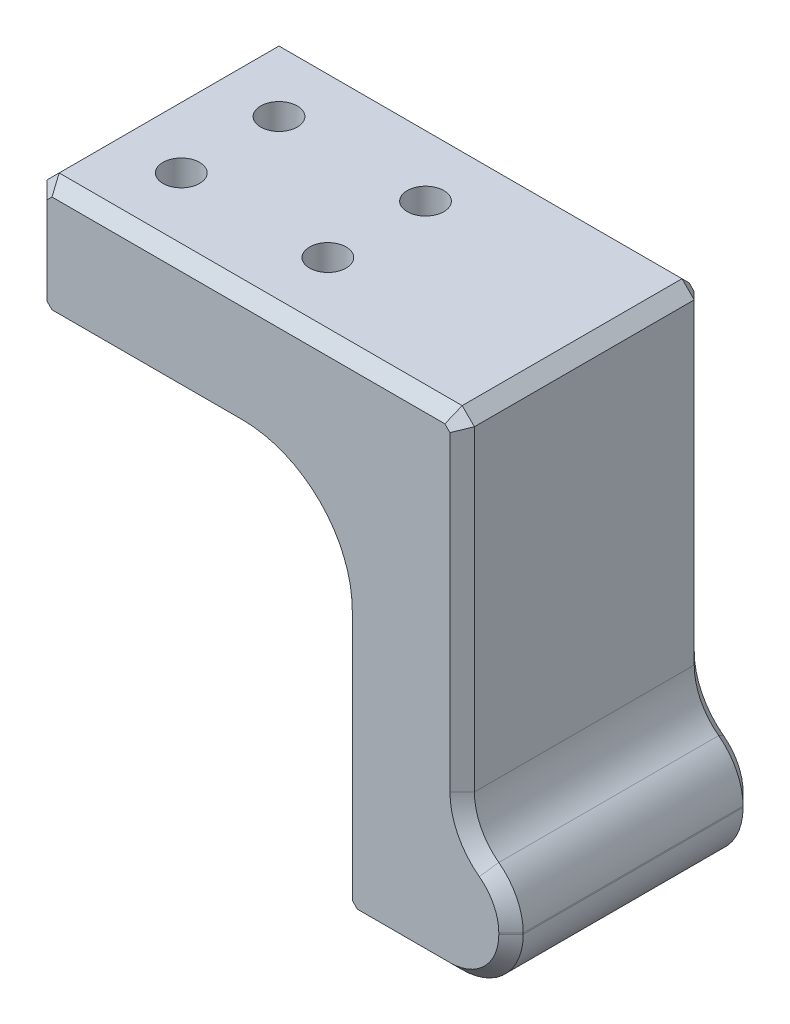
from build123d import *

# Parameters (mm, degrees)
EXTRUDE_3_DEPTH          = 20
FILLET_3_R               = 5
FILLET_4_R               = 5
FILLET_5_R               = 8
CUT_EXTRUDE_1_DEPTH      = 20
CUT_EXTRUDE_1_DEPTH_BACK = 20
SKETCH_6_R               = 1.5
CHAMFER_1_SIZE           = 1
CHAMFER_2_SIZE           = 1


with BuildPart() as part:
    # 草图5 → 凸台-拉伸3 (new body)
    with BuildSketch(Plane.XY):
        Polygon((-8.414313081, 8), (26.585686919, 8), (26.585686919, -22), (30.585686919, -22), (30.585686919, -32), (16.585686919, -32), (16.585686919, -2), (-8.414313081, -2), align=None)
    extrude(amount=EXTRUDE_3_DEPTH)

    # 圆角3
    # the kernel refuses this fillet: 5 mm, written as the material it takes off along each edge
    with BuildSketch(Plane(origin=(30.585686919, -32, -12.5), x_dir=(0, 1, 0), z_dir=(0, 0, 1))) as fillet_3_piece_1:
        with BuildLine():
            CenterArc((FILLET_3_R, FILLET_3_R), FILLET_3_R, 180, 90)
            Line((0, FILLET_3_R), (-FILLET_3_R * 0.02, FILLET_3_R))
            Line((-FILLET_3_R * 0.02, FILLET_3_R), (-FILLET_3_R * 0.02, -FILLET_3_R * 0.02))
            Line((-FILLET_3_R * 0.02, -FILLET_3_R * 0.02), (FILLET_3_R, -FILLET_3_R * 0.02))
            Line((FILLET_3_R, -FILLET_3_R * 0.02), (FILLET_3_R, 0))
        make_face()
    extrude(amount=45, mode=Mode.SUBTRACT)
    with BuildSketch(Plane(origin=(30.585686919, -22, -12.247448714), x_dir=(-1.0, -1.569411267609618e-12, 0), z_dir=(0, 0, 1))) as fillet_3_piece_2:
        with BuildLine():
            CenterArc((5, 4.898979486), FILLET_3_R, 180, 78.463040967)
            Line((0, 4.898979486), (-0.1, 4.898979486))
            Line((-0.1, 4.898979486), (-0.1, 0))
            Line((-0.1, 0), (0, -0.1))
            ThreePointArc((0, -0.1), (2, -0.1), (3.98, -0.09797959))
            Line((3.98, -0.09797959), (4, 0))
        make_face()
    extrude(amount=44.494897428, mode=Mode.SUBTRACT)

    # 圆角4
    fillet_4_edges = [part.edges().sort_by_distance(p)[0] for p in [
        (26.585686919, -22, 10),
    ]]
    fillet(fillet_4_edges, radius=FILLET_4_R)

    # 圆角5
    fillet_5_edges = [part.edges().sort_by_distance(p)[0] for p in [
        (16.585686919, -2, 10),
    ]]
    fillet(fillet_5_edges, radius=FILLET_5_R)

    # 草图6 → 切除-拉伸1 (cut, two sides: drawn at the far end of the back side and taken through both)
    with BuildSketch(Plane(origin=(0, -2, 0), x_dir=(-1, 0, 0), z_dir=(0, -1, 0)).offset(-CUT_EXTRUDE_1_DEPTH_BACK)):
        with Locations((2.414313081, -14)):
            Circle(SKETCH_6_R)
        with Locations((2.414313081, -6)):
            Circle(SKETCH_6_R)
        with Locations(Location((-9.585686919, -6, 0), (0, 0, 48.189685104))):
            Circle(SKETCH_6_R)
        with Locations(Location((-9.585686919, -14, 0), (0, 0, 48.189685104))):
            Circle(SKETCH_6_R)
    extrude(amount=CUT_EXTRUDE_1_DEPTH + CUT_EXTRUDE_1_DEPTH_BACK, mode=Mode.SUBTRACT)

    # 倒角1
    chamfer_1_edges = [part.edges().sort_by_distance(p)[0] for p in [
        (-8.414313081, 8, 10),
        (26.585686919, 8, 10),
        (16.585686919, -32, 10),
        (-8.414313081, -2, 10),
    ]]
    chamfer(chamfer_1_edges, length=CHAMFER_1_SIZE)

    # 倒角2
    chamfer_2_edges = [part.edges().sort_by_distance(p)[0] for p in [
        (30.585686919, -26.949489743, 0),
        (30.585686919, -26.949489743, 20),
        (29.121220825, -30.535533906, 0),
        (30.057822874, -24.662911508, 20),
        (29.121220825, -30.535533906, 20),
        (26.585686919, -5.949489743, 0),
        (26.585686919, -5.949489743, 20),
        (30.057822874, -24.662911508, 0),
        (27.113550964, -21.135047463, 0),
        (27.113550964, -21.135047463, 20),
        (16.585686919, -20.5, 0),
        (16.585686919, -20.5, 20),
        (14.242541169, -4.343145751, 0),
        (14.242541169, -4.343145751, 20),
        (9.085686919, 8, 0),
        (9.085686919, 8, 20),
        (21.585686919, -32, 0),
        (0.585686919, -2, 0),
        (-8.414313081, 3, 0),
        (17.085686919, -31.5, 0),
        (-7.914313081, -1.5, 0),
        (-7.914313081, 7.5, 0),
        (26.085686919, 7.5, 0),
        (21.585686919, -32, 20),
        (-8.414313081, 3, 20),
        (0.585686919, -2, 20),
        (17.085686919, -31.5, 20),
        (-7.914313081, -1.5, 20),
        (-7.914313081, 7.5, 20),
        (26.085686919, 7.5, 20),
    ]]
    chamfer(chamfer_2_edges, length=CHAMFER_2_SIZE)


solid = part.part
